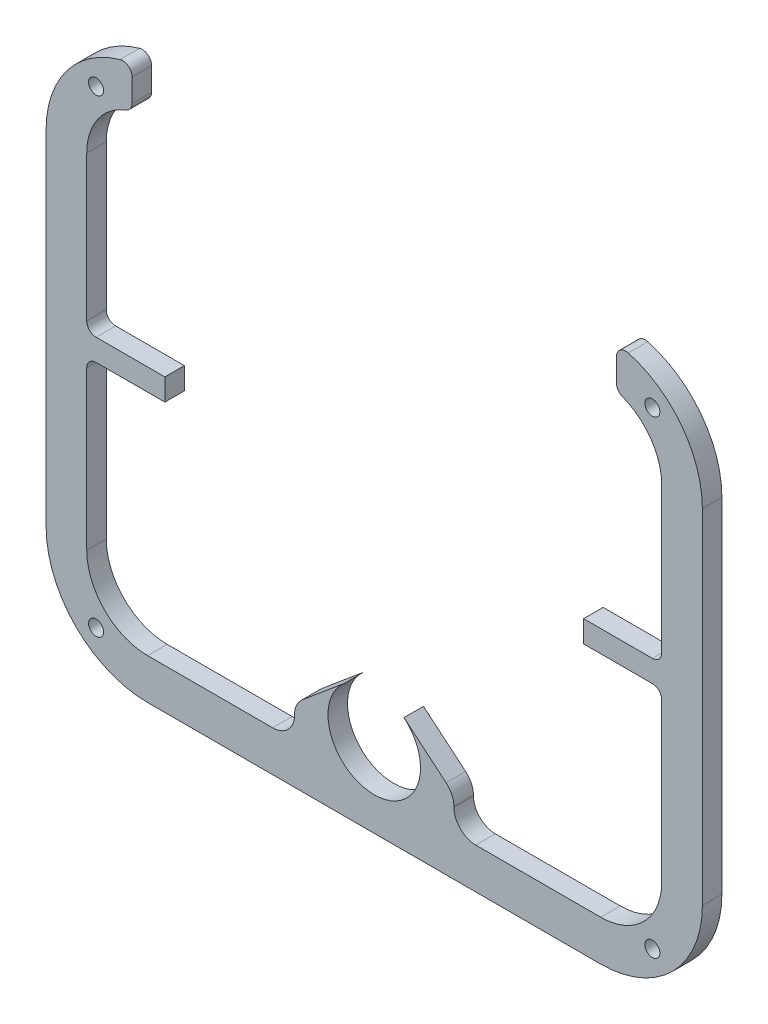
from build123d import *

# Parameters (mm, degrees)
SKETCH1_R           = 0.6096
BOSS_EXTRUDE1_DEPTH = 1.5875
CUT_EXTRUDE1_REACH  = 36.753
SKETCH2_W           = 3.155094666
SKETCH2_H           = 2.647438771
FILLET1_R           = 1.778
FILLET2_R           = 0.762
FILLET3_R           = 0.762


with BuildPart() as part:
    # Sketch1 → Boss-Extrude1 (new body)
    with BuildSketch(Plane.XY):
        with BuildLine():
            ThreePointArc((26.67, 13.97), (24.252166479, 19.807166479), (18.415, 22.225))
            Line((18.415, 22.225), (-18.415, 22.225))
            ThreePointArc((-18.415, 22.225), (-24.252166479, 19.807166479), (-26.67, 13.97))
            Line((-26.67, 13.97), (-26.67, -13.97))
            ThreePointArc((-26.67, -13.97), (-24.252166479, -19.807166479), (-18.415, -22.225))
            Line((-18.415, -22.225), (18.415, -22.225))
            ThreePointArc((18.415, -22.225), (24.252166479, -19.807166479), (26.67, -13.97))
            Line((26.67, -13.97), (26.67, 13.97))
        make_face()
        with BuildLine():
            Line((-17.018, 1.397), (-23.368, 1.397))
            Line((-23.368, 1.397), (-23.368, 13.97))
            ThreePointArc((-23.368, 13.97), (-21.917299887, 17.472299887), (-18.415, 18.923))
            Line((-18.415, 18.923), (18.415, 18.923))
            ThreePointArc((18.415, 18.923), (21.917299887, 17.472299887), (23.368, 13.97))
            Line((23.368, 13.97), (23.368, 1.397))
            Line((23.368, 1.397), (17.018, 1.397))
            Line((17.018, 1.397), (17.018, -0.381))
            Line((17.018, -0.381), (23.368, -0.381))
            Line((23.368, -0.381), (23.368, -13.97))
            ThreePointArc((23.368, -13.97), (21.917299887, -17.472299887), (18.415, -18.923))
            Line((18.415, -18.923), (9.632094666, -18.923))
            Line((9.632094666, -18.923), (2.416367182, -12.868285729))
            ThreePointArc((2.416367182, -12.868285729), (0, -19.5072), (-2.416367182, -12.868285729))
            Line((-2.416367182, -12.868285729), (-9.632094666, -18.923))
            Line((-9.632094666, -18.923), (-18.415, -18.923))
            ThreePointArc((-18.415, -18.923), (-21.917299887, -17.472299887), (-23.368, -13.97))
            Line((-23.368, -13.97), (-23.368, -0.381))
            Line((-23.368, -0.381), (-17.018, -0.381))
            Line((-17.018, -0.381), (-17.018, 1.397))
        make_face(mode=Mode.SUBTRACT)
        with Locations((-22.606, -19.05)):
            Circle(SKETCH1_R, mode=Mode.SUBTRACT)
        with Locations((-22.606, 19.05)):
            Circle(SKETCH1_R, mode=Mode.SUBTRACT)
        with Locations((22.606, 19.05)):
            Circle(SKETCH1_R, mode=Mode.SUBTRACT)
        with Locations((22.606, -19.05)):
            Circle(SKETCH1_R, mode=Mode.SUBTRACT)
    extrude(amount=BOSS_EXTRUDE1_DEPTH)

    # Sketch2 → Cut-Extrude1 (cut, up to next)
    with BuildSketch(Plane.XY.offset(1.5875), mode=Mode.PRIVATE) as cut_extrude1_sk1:
        with Locations((-8.054547333, -17.599280615)):
            Rectangle(SKETCH2_W, SKETCH2_H)
    cut_extrude1_tool1 = extrude(cut_extrude1_sk1.sketch, amount=-CUT_EXTRUDE1_REACH, mode=Mode.PRIVATE) & part.part
    # Sketch2 → Cut-Extrude1 (cut, up to next)
    with BuildSketch(Plane.XY.offset(1.5875), mode=Mode.PRIVATE) as cut_extrude1_sk2:
        with Locations((8.054547333, -17.599280615)):
            Rectangle(SKETCH2_W, SKETCH2_H)
    cut_extrude1_tool2 = extrude(cut_extrude1_sk2.sketch, amount=-CUT_EXTRUDE1_REACH, mode=Mode.PRIVATE) & part.part
    # Sketch2 → Cut-Extrude1 (cut, up to next)
    with BuildSketch(Plane.XY.offset(1.5875), mode=Mode.PRIVATE) as cut_extrude1_sk3:
        with BuildLine():
            Line((-18.415, 18.923), (18.415, 18.923))
            ThreePointArc((18.415, 18.923), (19.055374802, 18.881428419), (19.685, 18.757411514))
            Line((19.685, 18.757411514), (19.685, 22.225))
            Line((19.685, 22.225), (-19.685, 22.225))
            Line((-19.685, 22.225), (-19.685, 18.757411514))
            ThreePointArc((-19.685, 18.757411514), (-19.055374802, 18.881428419), (-18.415, 18.923))
        make_face()
    cut_extrude1_tool3 = extrude(cut_extrude1_sk3.sketch, amount=-CUT_EXTRUDE1_REACH, mode=Mode.PRIVATE) & part.part
    add(cut_extrude1_tool1.solids().sort_by_distance((-8.054547, -17.599281, 1.5875))[0], mode=Mode.SUBTRACT)
    add(cut_extrude1_tool2.solids().sort_by_distance((8.054547, -17.599281, 1.5875))[0], mode=Mode.SUBTRACT)
    add(cut_extrude1_tool3.solids().sort_by_distance((0, 20.57218, 1.5875))[0], mode=Mode.SUBTRACT)

    # Fillet1
    fillet1_edges = [part.edges().sort_by_distance(p)[0] for p in [
        (6.477, -18.923, 0.79375),
        (6.477, -16.275561229, 0.79375),
        (-6.477, -18.923, 0.79375),
        (-6.477, -16.275561229, 0.79375),
    ]]
    fillet(fillet1_edges, radius=FILLET1_R)

    # Fillet2
    fillet2_edges = [part.edges().sort_by_distance(p)[0] for p in [
        (19.685, 22.126722687, 0.79375),
        (19.685, 18.757411514, 0.79375),
        (-19.685, 18.757411514, 0.79375),
        (-19.685, 22.126722687, 0.79375),
    ]]
    fillet(fillet2_edges, radius=FILLET2_R)

    # Fillet3
    fillet3_edges = [part.edges().sort_by_distance(p)[0] for p in [
        (-23.368, -0.381, 0.79375),
        (23.368, -0.381, 0.79375),
        (23.368, 1.397, 0.79375),
        (-23.368, 1.397, 0.79375),
    ]]
    fillet(fillet3_edges, radius=FILLET3_R)


solid = part.part
